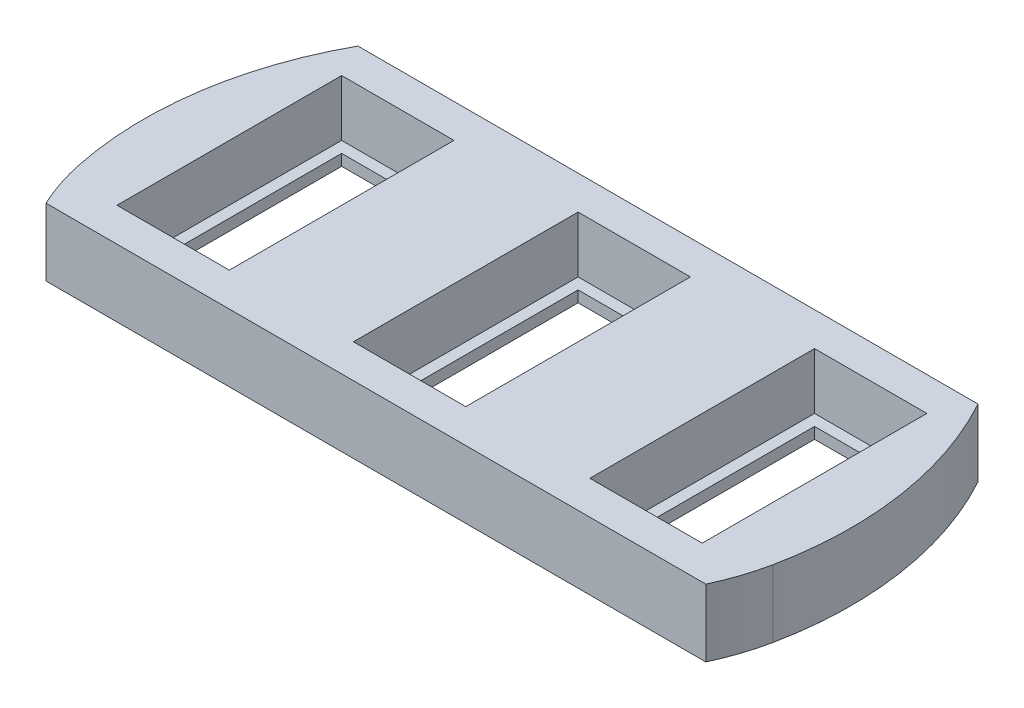
from build123d import *

# Parameters (mm, degrees)
ESQUISSE1_W        = 8
ESQUISSE1_H        = 18
BOSS_EXTRU_1_DEPTH = 1
ESQUISSE2_W        = 10
ESQUISSE2_H        = 20
BOSS_EXTRU_2_DEPTH = 5


with BuildPart() as part:
    # Esquisse1 → Boss.-Extru.1 (new body)
    with BuildSketch(Plane(origin=(0, 0, 0), x_dir=(1, 0, 0), z_dir=(0, 1, 0))):
        with BuildLine():
            Line((27.598833694, 12.184017214), (-27.598833694, 12.184017214))
            ThreePointArc((-27.598833694, 12.184017214), (-31.145098469, 1.715171403), (-30.856561938, -9.33423913))
            ThreePointArc((-30.856561938, -9.33423913), (-30.24469487, -11.619222792), (-29.367325409, -13.815982786))
            Line((-29.367325409, -13.815982786), (29.367325409, -13.815982786))
            ThreePointArc((29.367325409, -13.815982786), (30.24469487, -11.619222792), (30.856561938, -9.33423913))
            ThreePointArc((30.856561938, -9.33423913), (31.145098469, 1.715171403), (27.598833694, 12.184017214))
        make_face()
        with Locations((21.048231005, -0.815982786)):
            Rectangle(ESQUISSE1_W, ESQUISSE1_H, mode=Mode.SUBTRACT)
        with Locations((-21.048231005, -0.815982786)):
            Rectangle(ESQUISSE1_W, ESQUISSE1_H, mode=Mode.SUBTRACT)
        with Locations((0, -0.815982786)):
            Rectangle(ESQUISSE1_W, ESQUISSE1_H, mode=Mode.SUBTRACT)
    extrude(amount=BOSS_EXTRU_1_DEPTH)

    # Esquisse2 → Boss.-Extru.2 (add)
    with BuildSketch(Plane(origin=(0, 1, 0), x_dir=(1, 0, 0), z_dir=(0, 1, 0))):
        with BuildLine():
            Line((-27.598833694, 12.184017214), (27.598833694, 12.184017214))
            ThreePointArc((27.598833694, 12.184017214), (31.145098469, 1.715171403), (30.856561938, -9.33423913))
            ThreePointArc((30.856561938, -9.33423913), (30.410230407, -11.097286385), (29.805590259, -12.8125))
            ThreePointArc((29.805590259, -12.8125), (29.593326789, -13.317241366), (29.367325409, -13.815982786))
            Line((29.367325409, -13.815982786), (0, -13.815982786))
            Line((0, -13.815982786), (-29.367325409, -13.815982786))
            ThreePointArc((-29.367325409, -13.815982786), (-29.593326789, -13.317241366), (-29.805590259, -12.8125))
            ThreePointArc((-29.805590259, -12.8125), (-30.410230407, -11.097286385), (-30.856561938, -9.33423913))
            ThreePointArc((-30.856561938, -9.33423913), (-31.145098469, 1.715171403), (-27.598833694, 12.184017214))
        make_face()
        with Locations((-21.048231005, -0.815982786)):
            Rectangle(ESQUISSE2_W, ESQUISSE2_H, mode=Mode.SUBTRACT)
        with Locations((21.048231005, -0.815982786)):
            Rectangle(ESQUISSE2_W, ESQUISSE2_H, mode=Mode.SUBTRACT)
        with Locations((0, -0.815982786)):
            Rectangle(ESQUISSE2_W, ESQUISSE2_H, mode=Mode.SUBTRACT)
    extrude(amount=BOSS_EXTRU_2_DEPTH)


solid = part.part
